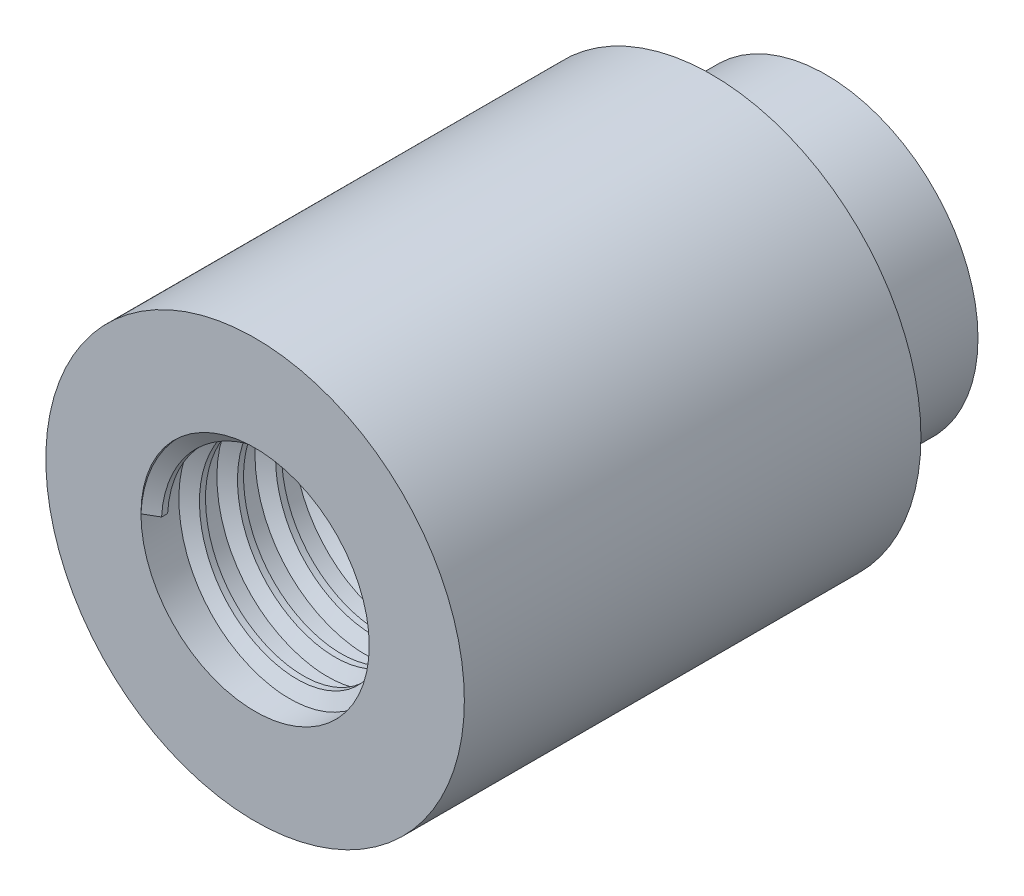
from build123d import *

# Parameters (mm, degrees)
SKETCH_1_R      = 2
SKETCH_1_R_2    = 1.5
EXTRUDE_1_DEPTH = 1.5
EXTRUDE_START   = 6
SKETCH_2_R      = 2.75
SKETCH_2_R_2    = 1.5
EXTRUDE_2_DEPTH = 6
THREAD_1_PITCH  = 0.5


with BuildPart() as part:
    # Sketch 1 → 凸台-拉伸1 (new body)
    with BuildSketch(Plane.XY.offset(121.617561)):
        with Locations((-65.065826, 36.048032)):
            Circle(SKETCH_1_R)
        with Locations((-65.065826, 36.048032)):
            Circle(SKETCH_1_R_2, mode=Mode.SUBTRACT)
    extrude(amount=-EXTRUDE_1_DEPTH)

    # 草图2 → 凸台-拉伸2 (add)
    with BuildSketch(Plane.XY.offset(121.617561).offset(EXTRUDE_START)):
        with Locations((-65.065826, 36.048032)):
            Circle(SKETCH_2_R)
        with Locations((-65.065826, 36.048032)):
            Circle(SKETCH_2_R_2, mode=Mode.SUBTRACT)
    extrude(amount=-EXTRUDE_2_DEPTH)

    # 螺纹线1: the profile of Sketch 1 2 profile screwed along a right-hand helix of 15 turns, 6 arcs to a turn; built about Z, then put on its axis
    thread_1_z = Axis((0, 0, 0), (0, 0, 1))
    thread_1_corners = [(1.5003, 0, -0.000173), (1.5003, 0, 0.277986), (1.328148, 0, 0.178594), (1.328148, 0, 0.099219)]
    with BuildLine(mode=Mode.PRIVATE) as thread_1_profile:
        Line(thread_1_corners[0], thread_1_corners[1])
        Line(thread_1_corners[1], thread_1_corners[2])
        Line(thread_1_corners[2], thread_1_corners[3])
        Line(thread_1_corners[3], thread_1_corners[0])
    thread_1_cap = Face(thread_1_profile.wire())
    thread_1_turn_angles = [0, 30, 60, 90, 120, 150, 180, 210, 240, 270, 300, 330, 360]
    thread_1_turn_weights = [1, 0.8660254037844387, 1, 0.8660254037844387, 1, 0.8660254037844387, 1, 0.8660254037844387, 1, 0.8660254037844387, 1, 0.8660254037844387, 1]
    thread_1_turn_rails = [Edge.make_bspline([Vector(p[0], p[1], 0).rotate(thread_1_z, thread_1_turn_angles[k]) / thread_1_turn_weights[k] + Vector(0, 0, p[2] + THREAD_1_PITCH * thread_1_turn_angles[k] / 360) for k in range(13)], [0, 0, 0, 1, 1, 2, 2, 3, 3, 4, 4, 5, 5, 6, 6, 6], 2, thread_1_turn_weights) for p in thread_1_corners]
    thread_1_turn_sides = [Face.make_surface_from_curves(thread_1_turn_rails[p[0]], thread_1_turn_rails[p[1]]) for p in [(0, 1), (1, 2), (2, 3), (3, 0)]]
    thread_1 = Plane(origin=(-65.065826, 36.048032, 127.617561), x_dir=(-1, 0, 0), z_dir=(0, 0, -1)) * Solid(Shell([*[p.moved(Location((0, 0, THREAD_1_PITCH * i))) for i in range(15) for p in thread_1_turn_sides], thread_1_cap, thread_1_cap.rotate(thread_1_z, 5400).moved(Location((0, 0, THREAD_1_PITCH * 5400 / 360)))]))
    add(thread_1)


solid = part.part
